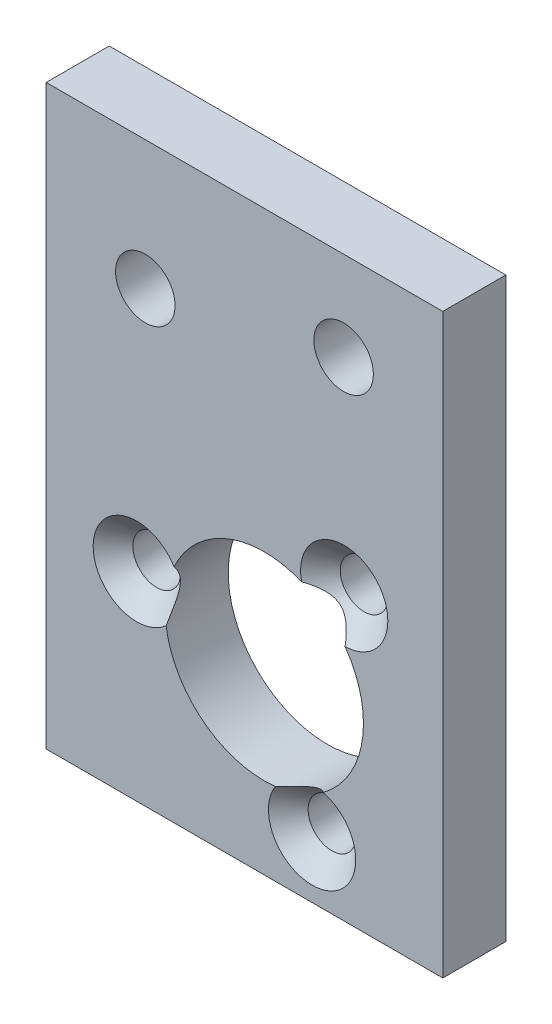
from build123d import *

# Parameters (mm, degrees)
SKETCH1_W                                       = 20
SKETCH1_H                                       = 29.11
SKETCH1_R                                       = 5
SKETCH1_R_2                                     = 1.5
SKETCH1_R_3                                     = 1.2
BOSS_EXTRUDE2_DEPTH                             = 3.18
CSK_FOR_M2_FLAT_HEAD_MACHINE_SCREW1_D           = 2.4
CSK_FOR_M2_FLAT_HEAD_MACHINE_SCREW1_DEPTH       = 3.508967257
CSK_FOR_M2_FLAT_HEAD_MACHINE_SCREW1_CSINK_D     = 4.4
CSK_FOR_M2_FLAT_HEAD_MACHINE_SCREW1_CSINK_ANGLE = 90
CSK_FOR_M2_FLAT_HEAD_MACHINE_SCREW1_TIP         = 0.721032743


with BuildPart() as part:
    # Sketch1 → Boss-Extrude2 (new body)
    with BuildSketch(Plane.XY):
        with Locations((10, 14.555)):
            Rectangle(SKETCH1_W, SKETCH1_H)
        with Locations((11, 9.11)):
            Circle(SKETCH1_R, mode=Mode.SUBTRACT)
        with Locations((5, 22.61)):
            Circle(SKETCH1_R_2, mode=Mode.SUBTRACT)
        with Locations((15, 24.61)):
            Circle(SKETCH1_R_2, mode=Mode.SUBTRACT)
        with Locations((15.03, 14.21)):
            Circle(SKETCH1_R_3, mode=Mode.SUBTRACT)
        with Locations((4.57, 10.04)):
            Circle(SKETCH1_R_3, mode=Mode.SUBTRACT)
        with Locations((13.41, 2.96)):
            Circle(SKETCH1_R_3, mode=Mode.SUBTRACT)
    extrude(amount=-BOSS_EXTRUDE2_DEPTH)

    # CSK for M2 Flat Head Machine Screw1
    with Locations(Plane.XY):
        with Locations((4.57, 10.04), (15.03, 14.21), (13.41, 2.96)):
            CounterSinkHole(CSK_FOR_M2_FLAT_HEAD_MACHINE_SCREW1_D / 2, CSK_FOR_M2_FLAT_HEAD_MACHINE_SCREW1_CSINK_D / 2, depth=CSK_FOR_M2_FLAT_HEAD_MACHINE_SCREW1_DEPTH, counter_sink_angle=CSK_FOR_M2_FLAT_HEAD_MACHINE_SCREW1_CSINK_ANGLE)
            with Locations((0, 0, -(CSK_FOR_M2_FLAT_HEAD_MACHINE_SCREW1_DEPTH + CSK_FOR_M2_FLAT_HEAD_MACHINE_SCREW1_TIP / 2))):  # 118° drill point
                Cone(0, CSK_FOR_M2_FLAT_HEAD_MACHINE_SCREW1_D / 2, CSK_FOR_M2_FLAT_HEAD_MACHINE_SCREW1_TIP, mode=Mode.SUBTRACT)


solid = part.part
